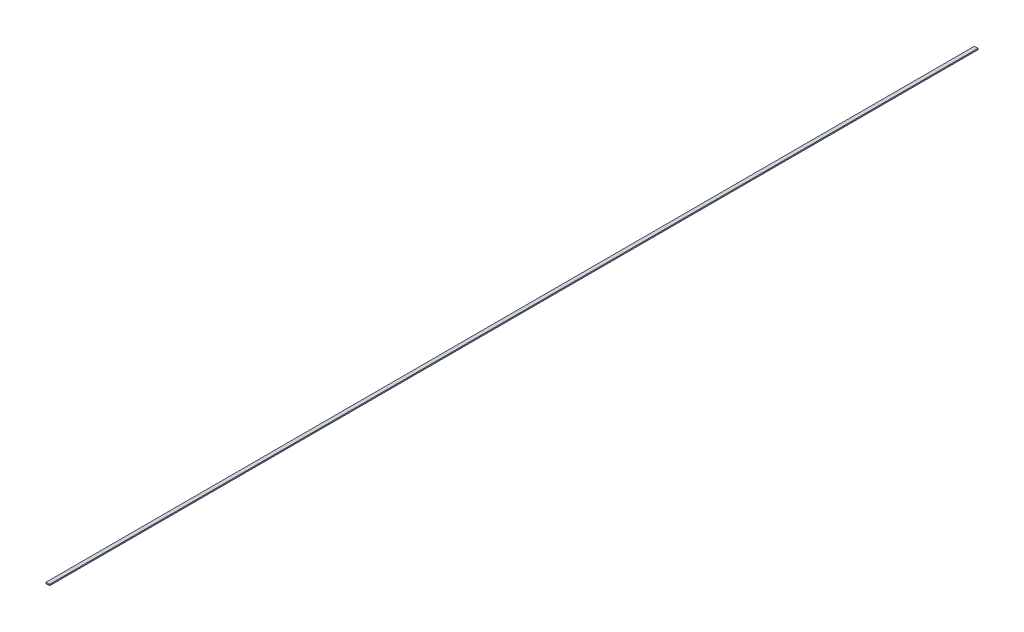
from build123d import *

# Parameters (mm, degrees)
SKETCH_1_W      = 3
SKETCH_1_H      = 1
EXTRUDE_1_DEPTH = 762


with BuildPart() as part:
    # 草图1 → 凸台-拉伸1 (new body)
    with BuildSketch(Plane.XY):
        with Locations((150.374543179, -5.69181804)):
            Rectangle(SKETCH_1_W, SKETCH_1_H)
    extrude(amount=EXTRUDE_1_DEPTH)


solid = part.part
